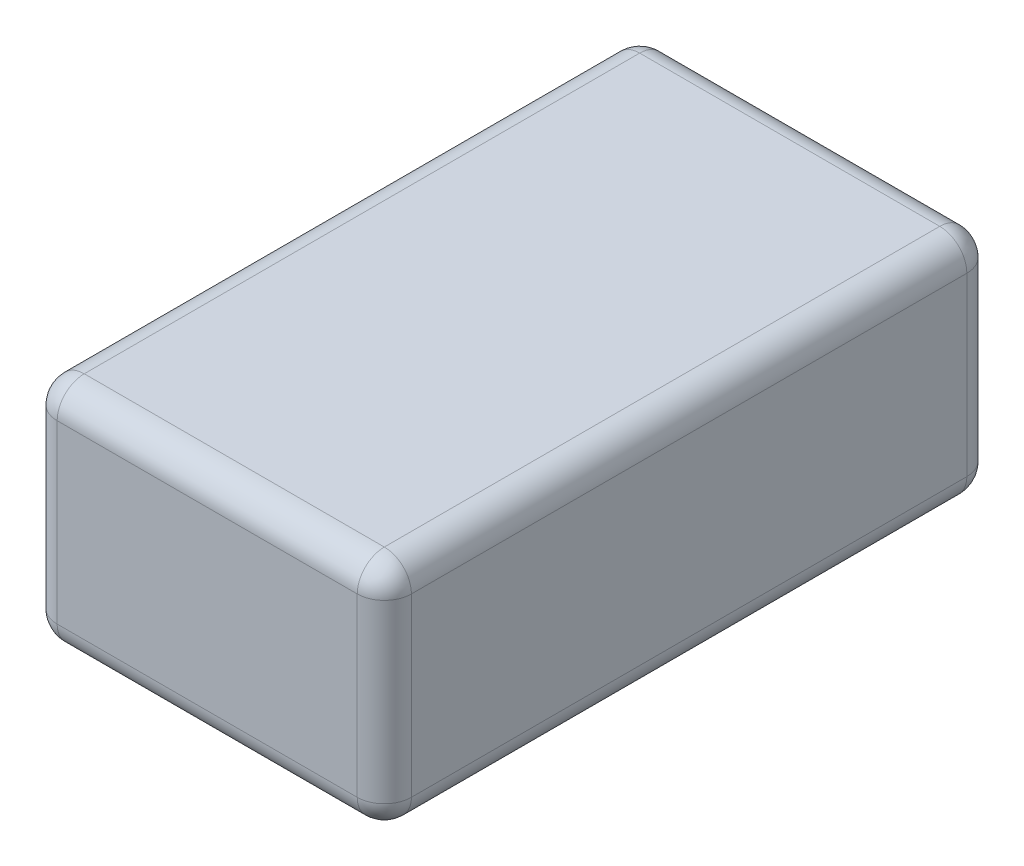
from build123d import *

# Parameters (mm, degrees)
SKETCH2_W           = 26.15
SKETCH2_H           = 45
BOSS_EXTRUDE1_DEPTH = 17
FILLET1_R           = 2
SKETCH3_R           = 4
SKETCH3_R_2         = 3
BOSS_EXTRUDE2_DEPTH = 2.8


with BuildPart() as part:
    # Sketch2 → Boss-Extrude1 (new body)
    with BuildSketch(Plane(origin=(0, 0, 0), x_dir=(1, 0, 0), z_dir=(0, 1, 0))):
        Rectangle(SKETCH2_W, SKETCH2_H)
    extrude(amount=BOSS_EXTRUDE1_DEPTH)

    # Fillet1
    fillet1_edges = [part.edges().sort_by_distance(p)[0] for p in [
        (-13.075, 0, 0),
        (-13.075, 8.5, -22.5),
        (0, 0, -22.5),
        (0, 0, 22.5),
        (-13.075, 8.5, 22.5),
        (13.075, 8.5, -22.5),
        (13.075, 0, 0),
        (0, 17, -22.5),
        (-13.075, 17, 0),
        (0, 17, 22.5),
        (13.075, 8.5, 22.5),
        (13.075, 17, 0),
    ]]
    fillet(fillet1_edges, radius=FILLET1_R)

    # Sketch3 → Boss-Extrude2 (add)
    with BuildSketch(Plane.XY.offset(-22.5)):
        with Locations((-6, 8.5)):
            Circle(SKETCH3_R)
        with Locations((6, 8.5)):
            Circle(SKETCH3_R_2)
    extrude(amount=-BOSS_EXTRUDE2_DEPTH)


solid = part.part
